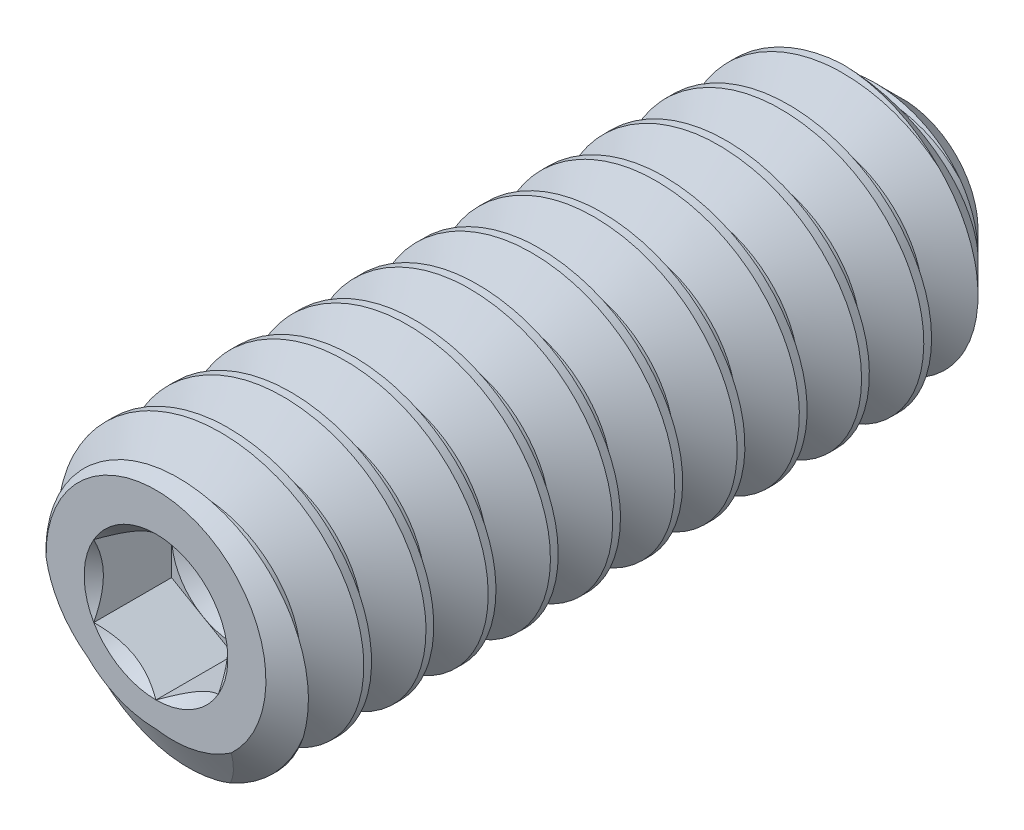
from build123d import *

# Parameters (mm, degrees)
CUT_SWEEP2_PITCH    = 0.79375
CUT_EXTRUDE10_DEPTH = 0.9921875


with BuildPart() as part:
    # Sketch22 → Revolve1 (revolve)
    with BuildSketch(Plane(origin=(0, 0, 0), x_dir=(0, 0, -1), z_dir=(1, 0, 0)), mode=Mode.PRIVATE) as revolve1_sk:
        Polygon((-4.473977758, 0), (-4.473977758, 1.40208), (-4.228541012, 1.7526), (4.258785537, 1.7526), (5.051022242, 0.960363295), (5.051022242, 0), (4.473977758, 0), align=None)
    revolve(revolve1_sk.sketch.rotate(Axis((0, 0, -4.473977758), (0, 0, -1)), 180), axis=Axis((0, 0, -4.473977758), (0, 0, -1)))

    # Cut-Sweep2: the profile of Sketch28 profile screwed along a right-hand helix of 13 turns, 8 arcs to a turn; built about Z, then put on its axis
    cut_sweep2_z = Axis((0, 0, 0), (0, 0, 1))
    cut_sweep2_corners = [(1.7529, 0, 0.000173205), (1.7529, 0, -0.694704455), (1.237044252, 0, -0.396875), (1.237044252, 0, -0.29765625)]
    with BuildLine(mode=Mode.PRIVATE) as cut_sweep2_profile:
        Line(cut_sweep2_corners[0], cut_sweep2_corners[1])
        Line(cut_sweep2_corners[1], cut_sweep2_corners[2])
        Line(cut_sweep2_corners[2], cut_sweep2_corners[3])
        Line(cut_sweep2_corners[3], cut_sweep2_corners[0])
    cut_sweep2_cap = Face(cut_sweep2_profile.wire())
    cut_sweep2_turn_angles = [0, 22.5, 45, 67.5, 90, 112.5, 135, 157.5, 180, 202.5, 225, 247.5, 270, 292.5, 315, 337.5, 360]
    cut_sweep2_turn_weights = [1, 0.9238795325112867, 1, 0.9238795325112867, 1, 0.9238795325112867, 1, 0.9238795325112867, 1, 0.9238795325112867, 1, 0.9238795325112867, 1, 0.9238795325112867, 1, 0.9238795325112867, 1]
    cut_sweep2_turn_rails = [Edge.make_bspline([Vector(p[0], p[1], 0).rotate(cut_sweep2_z, cut_sweep2_turn_angles[k]) / cut_sweep2_turn_weights[k] + Vector(0, 0, p[2] + CUT_SWEEP2_PITCH * cut_sweep2_turn_angles[k] / 360) for k in range(17)], [0, 0, 0, 1, 1, 2, 2, 3, 3, 4, 4, 5, 5, 6, 6, 7, 7, 8, 8, 8], 2, cut_sweep2_turn_weights) for p in cut_sweep2_corners]
    cut_sweep2_turn_sides = [Face.make_surface_from_curves(cut_sweep2_turn_rails[p[0]], cut_sweep2_turn_rails[p[1]]) for p in [(0, 1), (1, 2), (2, 3), (3, 0)]]
    cut_sweep2 = Plane(origin=(0, 0, -5.051022242), x_dir=(0, 1, 0), z_dir=(0, 0, 1)) * Solid(Shell([*[p.moved(Location((0, 0, CUT_SWEEP2_PITCH * i))) for i in range(13) for p in cut_sweep2_turn_sides], cut_sweep2_cap, cut_sweep2_cap.rotate(cut_sweep2_z, 4680).moved(Location((0, 0, CUT_SWEEP2_PITCH * 4680 / 360)))]))
    add(cut_sweep2, mode=Mode.SUBTRACT)

    # Sketch23 → Cut-Extrude10 (cut)
    with BuildSketch(Plane.XY.offset(4.473977758)):
        Polygon((0, 0.916543552), (-0.79375, 0.458271776), (-0.79375, -0.458271776), (0, -0.916543552), (0.79375, -0.458271776), (0.79375, 0.458271776), align=None)
    extrude(amount=-CUT_EXTRUDE10_DEPTH, mode=Mode.SUBTRACT)

    # Cut-Extrude11 cone 1 section (through the dimple's axis) → Cut-Extrude11 (revolve, cut)
    with BuildSketch(Plane(origin=(0, 0, 4.473977758), x_dir=(0, -1, 0), z_dir=(1, 0, 0))):
        Polygon((0, 0), (0.916543552, 0), (0, 0.916543552), align=None)
    revolve(axis=Axis((0, 0, 4.473977758), (0, 0, -1)), mode=Mode.SUBTRACT)

    # Cut-Extrude12 cone 1 section (through the dimple's axis) → Cut-Extrude12 (revolve, cut)
    with BuildSketch(Plane(origin=(0, 0, 3.481790258), x_dir=(0, -1, 0), z_dir=(1, 0, 0))):
        Polygon((0, 0), (0.79375, 0), (0, 0.458271776), align=None)
    revolve(axis=Axis((0, 0, 3.481790258), (0, 0, -1)), mode=Mode.SUBTRACT)


solid = part.part
